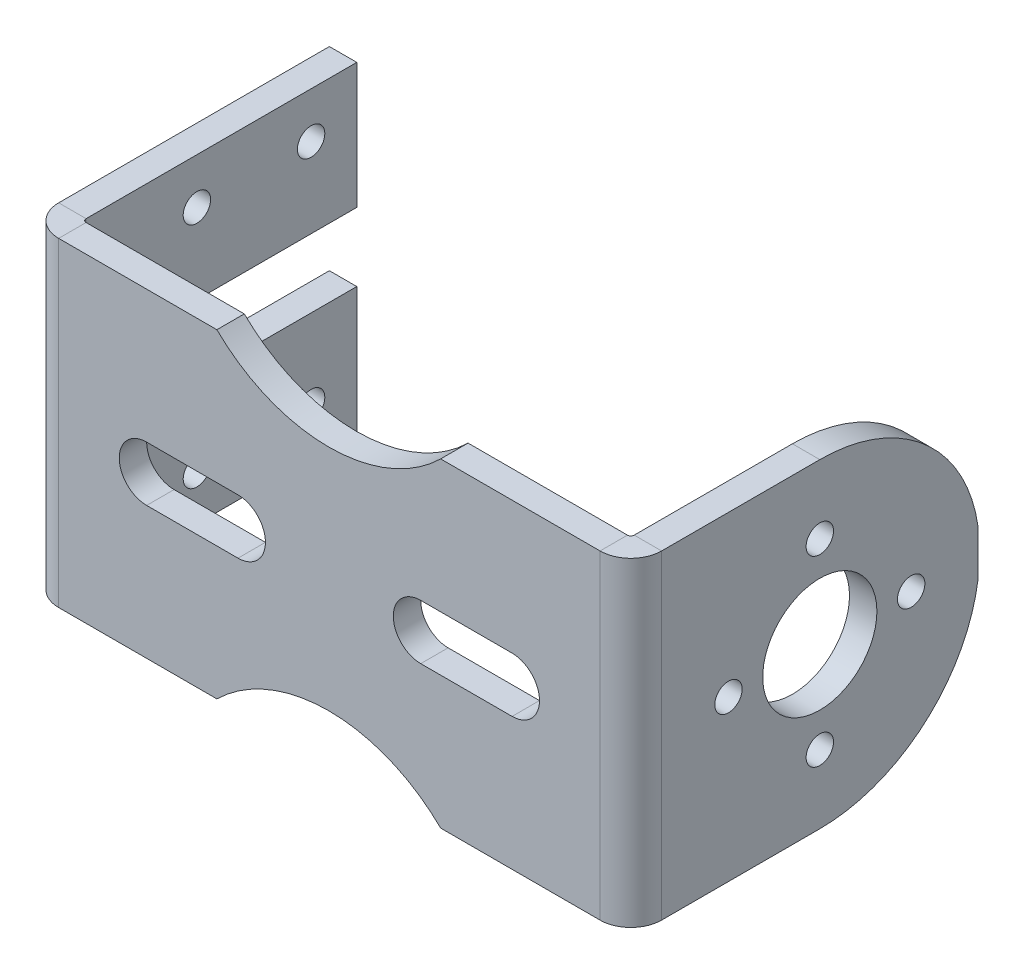
from build123d import *

# Parameters (mm, degrees)
BASE_FLANGE1_DEPTH = 70
CUT_EXTRUDE1_DEPTH = 10
CUT_EXTRUDE3_START = -6
CUT_EXTRUDE3_DEPTH = 6
SKETCH8_R          = 12.5
SKETCH8_R_2        = 3
CUT_EXTRUDE4_DEPTH = 10
CUT_EXTRUDE6_DEPTH = 10
SKETCH12_R         = 3
CUT_EXTRUDE7_DEPTH = 10


# Read off the part's stored shape, not the designer's step: Cut-Extrude3
# Sheet-metal steps are written as plain solids
with BuildPart() as part:
    # Sketch1 → Base-Flange1 (new body)
    with BuildSketch(Plane(origin=(0, 0, 0), x_dir=(1, 0, 0), z_dir=(0, 1, 0))):
        with BuildLine():
            Line((0, 60), (0, 0.7366))
            ThreePointArc((0, 0.7366), (0.215745145, 0.215745145), (0.7366, 0))
            Line((0.7366, 0), (119.2634, 0))
            ThreePointArc((119.2634, 0), (119.784254855, 0.215745145), (120, 0.7366))
            Line((120, 0.7366), (120, 70))
            Line((120, 70), (126, 70))
            Line((126, 70), (126, 0.7366))
            ThreePointArc((126, 0.7366), (124.026895542, -4.026895542), (119.2634, -6))
            Line((119.2634, -6), (0.7366, -6))
            ThreePointArc((0.7366, -6), (-4.026895542, -4.026895542), (-6, 0.7366))
            Line((-6, 0.7366), (-6, 60))
            Line((-6, 60), (0, 60))
        make_face()
    extrude(amount=BASE_FLANGE1_DEPTH)

    # Sketch6 → Cut-Extrude1 (cut)
    with BuildSketch(Plane.XY.offset(6)):
        with BuildLine():
            Line((40, 29), (20, 29))
            ThreePointArc((20, 29), (14, 35), (20, 41))
            Line((20, 41), (40, 41))
            ThreePointArc((40, 41), (46, 35), (40, 29))
        make_face()
        with BuildLine():
            Line((80, 41), (100, 41))
            ThreePointArc((100, 41), (106, 35), (100, 29))
            Line((100, 29), (80, 29))
            ThreePointArc((80, 29), (74, 35), (80, 41))
        make_face()
    extrude(amount=-CUT_EXTRUDE1_DEPTH, mode=Mode.SUBTRACT)

    # Cut-Extrude3 outline → Cut-Extrude3 (cut)
    with BuildSketch(Plane(origin=(126, 0, 0), x_dir=(0, 0, -1), z_dir=(1, 0, 0)).offset(CUT_EXTRUDE3_START)):
        with BuildLine():
            Line((70, 0), (70, 29.935875682))
            ThreePointArc((70, 29.935875682), (58.256677497, 8.521288257), (35.3683, 0))
            Line((35.3683, 0), (70, 0))
        make_face()
        with BuildLine():
            ThreePointArc((35.3683, 70), (58.256677497, 61.478711743), (70, 40.064124318))
            Line((70, 40.064124318), (70, 70))
            Line((70, 70), (35.3683, 70))
        make_face()
    extrude(amount=CUT_EXTRUDE3_DEPTH, mode=Mode.SUBTRACT)

    # Sketch8 → Cut-Extrude4 (cut)
    with BuildSketch(Plane(origin=(126, 0, 0), x_dir=(0, 0, -1), z_dir=(1, 0, 0))):
        with Locations((35.3683, 35)):
            Circle(SKETCH8_R)
        with Locations((35.3683, 55)):
            Circle(SKETCH8_R_2)
        with Locations((55.3683, 35)):
            Circle(SKETCH8_R_2)
        with Locations((35.3683, 15)):
            Circle(SKETCH8_R_2)
        with Locations((15.3683, 35)):
            Circle(SKETCH8_R_2)
    extrude(amount=-CUT_EXTRUDE4_DEPTH, mode=Mode.SUBTRACT)

    # Sketch9 → Cut-Extrude6 (cut)
    with BuildSketch(Plane(origin=(0, 0, 0), x_dir=(-1, 0, 0), z_dir=(0, 0, -1))):
        with BuildLine():
            Line((-84.363131417, 70), (-35.373336561, 70))
            ThreePointArc((-35.373336561, 70), (-59.868233989, 60), (-84.363131417, 70))
        make_face()
        with BuildLine():
            Line((-84.363131417, 0), (-35.373336561, 0))
            ThreePointArc((-35.373336561, 0), (-59.868233989, 10), (-84.363131417, 0))
        make_face()
    extrude(amount=-CUT_EXTRUDE6_DEPTH, mode=Mode.SUBTRACT)

    # Sketch12 → Cut-Extrude7 (cut)
    with BuildSketch(Plane.ZY.offset(6)):
        with Locations((-50, 60)):
            Circle(SKETCH12_R)
        with Locations(Location((-25, 60, 0), (0, 0, 180))):
            Circle(SKETCH12_R)
        with Locations((-25, 10)):
            Circle(SKETCH12_R)
        with Locations(Location((-50, 10, 0), (0, 0, 180))):
            Circle(SKETCH12_R)
        with BuildLine():
            Line((-60, 42.5), (-25, 42.5))
            ThreePointArc((-25, 42.5), (-17.5, 35), (-25, 27.5))
            Line((-25, 27.5), (-60, 27.5))
            Line((-60, 27.5), (-60, 42.5))
        make_face()
    extrude(amount=-CUT_EXTRUDE7_DEPTH, mode=Mode.SUBTRACT)


solid = part.part
